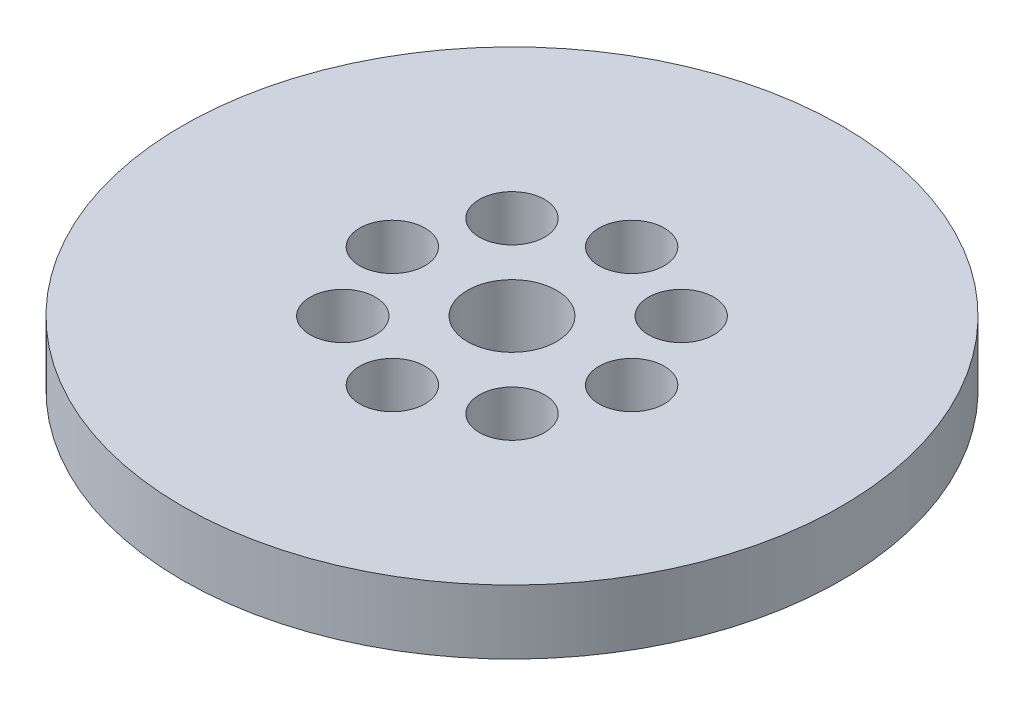
from build123d import *

# Parameters (mm, degrees)
SKETCH1_R           = 92.5
BOSS_EXTRUDE1_DEPTH = 18
SKETCH2_R           = 12.5
CUT_EXTRUDE1_DEPTH  = 133.047339996
SKETCH3_R           = 9.172934827
CUT_EXTRUDE2_DEPTH  = 17.521190371
CIRPATTERN1_COUNT   = 8


with BuildPart() as part:
    # Sketch1 → Boss-Extrude1 (new body)
    with BuildSketch(Plane(origin=(0, 0, 0), x_dir=(1, 0, 0), z_dir=(0, 1, 0))):
        Circle(SKETCH1_R)
    extrude(amount=BOSS_EXTRUDE1_DEPTH)

    # Sketch2 → Cut-Extrude1 (cut, through all)
    with BuildSketch(Plane(origin=(0, 0, 0), x_dir=(1, 0, 0), z_dir=(0, 1, 0))):
        Circle(SKETCH2_R)
    extrude(amount=CUT_EXTRUDE1_DEPTH, mode=Mode.SUBTRACT)

    # Sketch3 → Cut-Extrude2 (cut)
    with BuildSketch(Plane(origin=(0, 18, 0), x_dir=(1, 0, 0), z_dir=(0, 1, 0))):
        with Locations((-33.581375972, 0)):
            Circle(SKETCH3_R)
    cut_extrude2 = extrude(amount=-CUT_EXTRUDE2_DEPTH, mode=Mode.SUBTRACT)

    # CirPattern1: Cut-Extrude2 ×8 about axis
    cirpattern1_axis = Axis((0, 0, 0), (0, 1, 0))
    for i in range(1, CIRPATTERN1_COUNT):
        add(cut_extrude2.rotate(cirpattern1_axis, i * 360 / CIRPATTERN1_COUNT), mode=Mode.SUBTRACT)


solid = part.part
